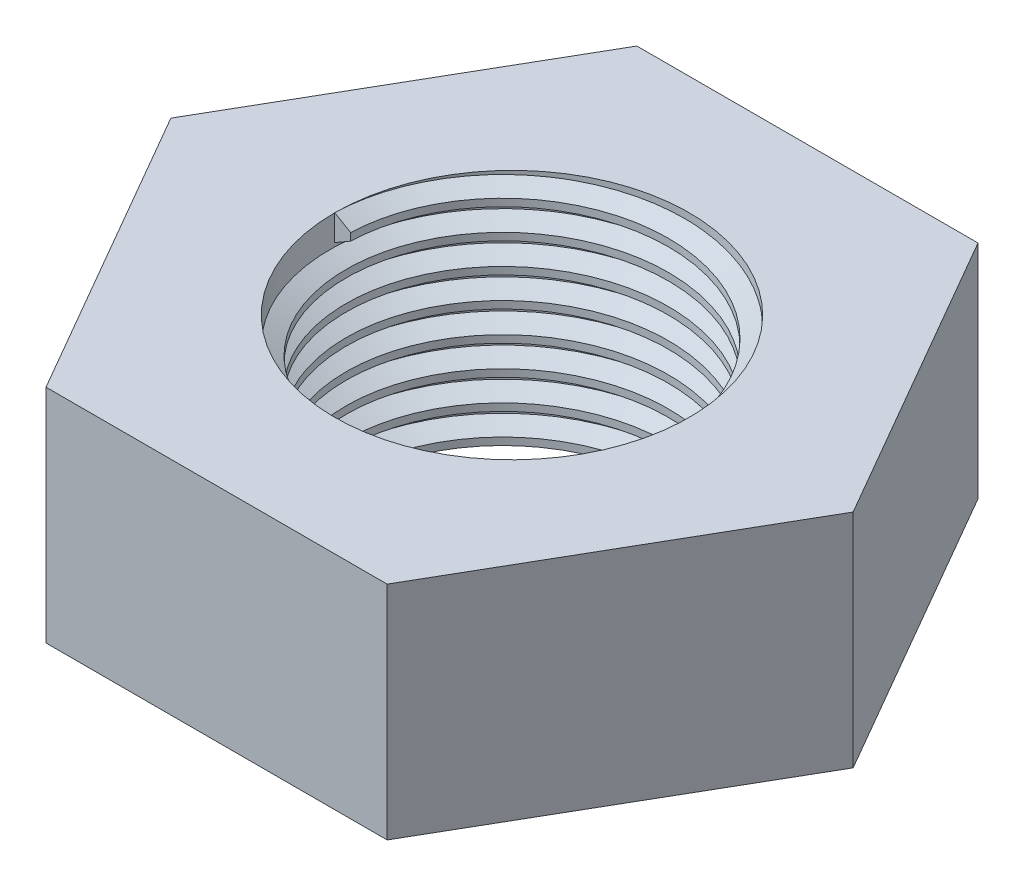
from build123d import *
from build123d.topology import SkipClean

# Parameters (mm, degrees)
BOSS_EXTRUDE1_DEPTH = 15
SKETCH3_R           = 12
CUT_EXTRUDE1_DEPTH  = 35.034296428
THREAD3_PITCH       = 2


with BuildPart() as part:
    # Sketch2 → Boss-Extrude1 (new body)
    with BuildSketch(Plane(origin=(0, 0, 0), x_dir=(1, 0, 0), z_dir=(0, 1, 0))):
        Polygon((23.094010768, 0), (11.547005384, 20), (-11.547005384, 20), (-23.094010768, 0), (-11.547005384, -20), (11.547005384, -20), align=None)
    extrude(amount=BOSS_EXTRUDE1_DEPTH)

    # Sketch3 → Cut-Extrude1 (cut, through all)
    with BuildSketch(Plane(origin=(0, 15, 0), x_dir=(1, 0, 0), z_dir=(0, 1, 0))):
        with Locations(Location((0, 0, 0), (0, 0, 270))):
            Circle(SKETCH3_R)
    extrude(amount=-CUT_EXTRUDE1_DEPTH, mode=Mode.SUBTRACT)

    # Thread3: the profile of Thread Profile3 profile screwed along a right-hand helix of 7.5 turns, 10 arcs to a turn; built about Z, then put on its axis
    with SkipClean():  # the faces are left unmerged after this step: merging them gives an invalid solid
        thread3_z = Axis((0, 0, 0), (0, 0, 1))
        thread3_corners = [(12.0003, 0, -0.000173205), (12.0003, 0, 1.7501732), (10.91746825, 0, 1.124999997), (10.91746825, 0, 0.624999997)]
        with BuildLine(mode=Mode.PRIVATE) as thread3_profile:
            Line(thread3_corners[0], thread3_corners[1])
            Line(thread3_corners[1], thread3_corners[2])
            Line(thread3_corners[2], thread3_corners[3])
            Line(thread3_corners[3], thread3_corners[0])
        thread3_cap = Face(thread3_profile.wire())
        thread3_turn_angles = [0, 18, 36, 54, 72, 90, 108, 126, 144, 162, 180, 198, 216, 234, 252, 270, 288, 306, 324, 342, 360]
        thread3_turn_weights = [1, 0.9510565162951535, 1, 0.9510565162951535, 1, 0.9510565162951535, 1, 0.9510565162951535, 1, 0.9510565162951535, 1, 0.9510565162951535, 1, 0.9510565162951535, 1, 0.9510565162951535, 1, 0.9510565162951535, 1, 0.9510565162951535, 1]
        thread3_turn_rails = [Edge.make_bspline([Vector(p[0], p[1], 0).rotate(thread3_z, thread3_turn_angles[k]) / thread3_turn_weights[k] + Vector(0, 0, p[2] + THREAD3_PITCH * thread3_turn_angles[k] / 360) for k in range(21)], [0, 0, 0, 1, 1, 2, 2, 3, 3, 4, 4, 5, 5, 6, 6, 7, 7, 8, 8, 9, 9, 10, 10, 10], 2, thread3_turn_weights) for p in thread3_corners]
        thread3_turn_sides = [Face.make_surface_from_curves(thread3_turn_rails[p[0]], thread3_turn_rails[p[1]]) for p in [(0, 1), (1, 2), (2, 3), (3, 0)]]
        thread3_last_angles = [2520, 2538, 2556, 2574, 2592, 2610, 2628, 2646, 2664, 2682, 2700]
        thread3_last_weights = [1, 0.9510565162951535, 1, 0.9510565162951535, 1, 0.9510565162951535, 1, 0.9510565162951535, 1, 0.9510565162951535, 1]
        thread3_last_rails = [Edge.make_bspline([Vector(p[0], p[1], 0).rotate(thread3_z, thread3_last_angles[k]) / thread3_last_weights[k] + Vector(0, 0, p[2] + THREAD3_PITCH * thread3_last_angles[k] / 360) for k in range(11)], [0, 0, 0, 1, 1, 2, 2, 3, 3, 4, 4, 5, 5, 5], 2, thread3_last_weights) for p in thread3_corners]
        thread3_last_sides = [Face.make_surface_from_curves(thread3_last_rails[p[0]], thread3_last_rails[p[1]]) for p in [(0, 1), (1, 2), (2, 3), (3, 0)]]
        thread3 = Plane(origin=(0, 15, 0), x_dir=(-1, 0, 0), z_dir=(0, -1, 0)) * Solid(Shell([*[p.moved(Location((0, 0, THREAD3_PITCH * i))) for i in range(7) for p in thread3_turn_sides], *thread3_last_sides, thread3_cap, thread3_cap.rotate(thread3_z, 2700).moved(Location((0, 0, THREAD3_PITCH * 2700 / 360)))]))
        add(thread3)


solid = part.part
